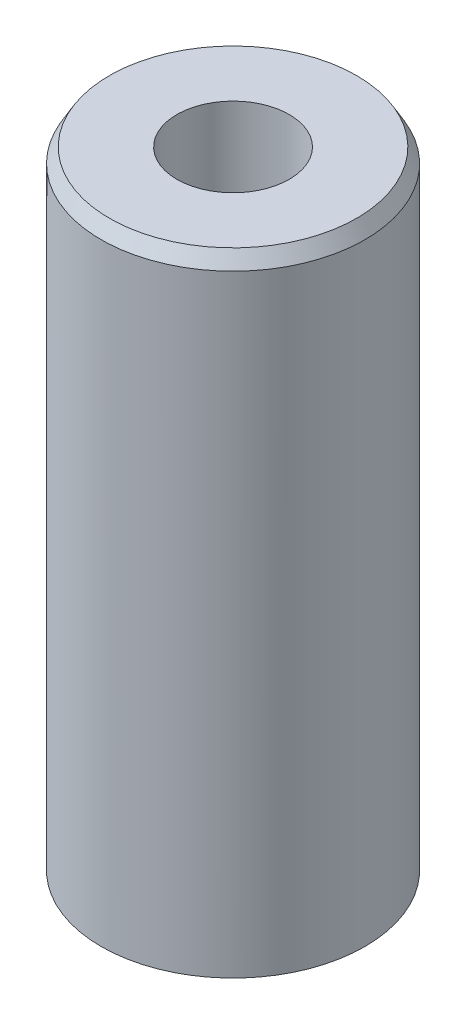
from build123d import *
from OCP.BRepFilletAPI import BRepFilletAPI_MakeChamfer

# Parameters (mm, degrees)
SKETCH1_R           = 50
BOSS_EXTRUDE1_DEPTH = 240.612343966
SKETCH2_R           = 21.291323499
CUT_EXTRUDE1_DEPTH  = 251.787360265
CHAMFER1_SIZE       = 5.450068308
CHAMFER1_SIZE2      = 3.146598404


with BuildPart() as part:
    # Sketch1 → Boss-Extrude1 (new body)
    with BuildSketch(Plane(origin=(0, 0, 0), x_dir=(1, 0, 0), z_dir=(0, 1, 0))):
        Circle(SKETCH1_R)
    extrude(amount=BOSS_EXTRUDE1_DEPTH)

    # Sketch2 → Cut-Extrude1 (cut, through all)
    with BuildSketch(Plane(origin=(0, 0, 0), x_dir=(1, 0, 0), z_dir=(0, 1, 0))):
        Circle(SKETCH2_R)
    extrude(amount=CUT_EXTRUDE1_DEPTH, mode=Mode.SUBTRACT)

    # Chamfer1: one chamfer whose edges measure the first distance from different faces: ONE call of the kernel's chamfer builder (chamfer() names one face for all edges)
    chamfer1_edges_1 = [part.edges().sort_by_distance(p)[0] for p in [
        (-50, 240.612343966, 0),
    ]]
    chamfer1_side_1 = [part.faces().sort_by_distance(p)[0] for p in [
        (-50, 120.306171983, 0),
    ]]
    chamfer1_edges_2 = [part.edges().sort_by_distance(p)[0] for p in [
        (-50, 0, 0),
    ]]
    chamfer1_side_2 = [part.faces().sort_by_distance(p)[0] for p in [
        (-48.585786438, 0, 0),
    ]]
    chamfer1 = BRepFilletAPI_MakeChamfer(part.part.solid().wrapped)
    for e in chamfer1_edges_1:
        chamfer1.Add(CHAMFER1_SIZE, CHAMFER1_SIZE2, e.wrapped, chamfer1_side_1[0].wrapped)  # the first distance lies on this face
    for e in chamfer1_edges_2:
        chamfer1.Add(CHAMFER1_SIZE, CHAMFER1_SIZE2, e.wrapped, chamfer1_side_2[0].wrapped)  # the first distance lies on this face
    add(Compound.cast(chamfer1.Shape()), mode=Mode.REPLACE)


solid = part.part
